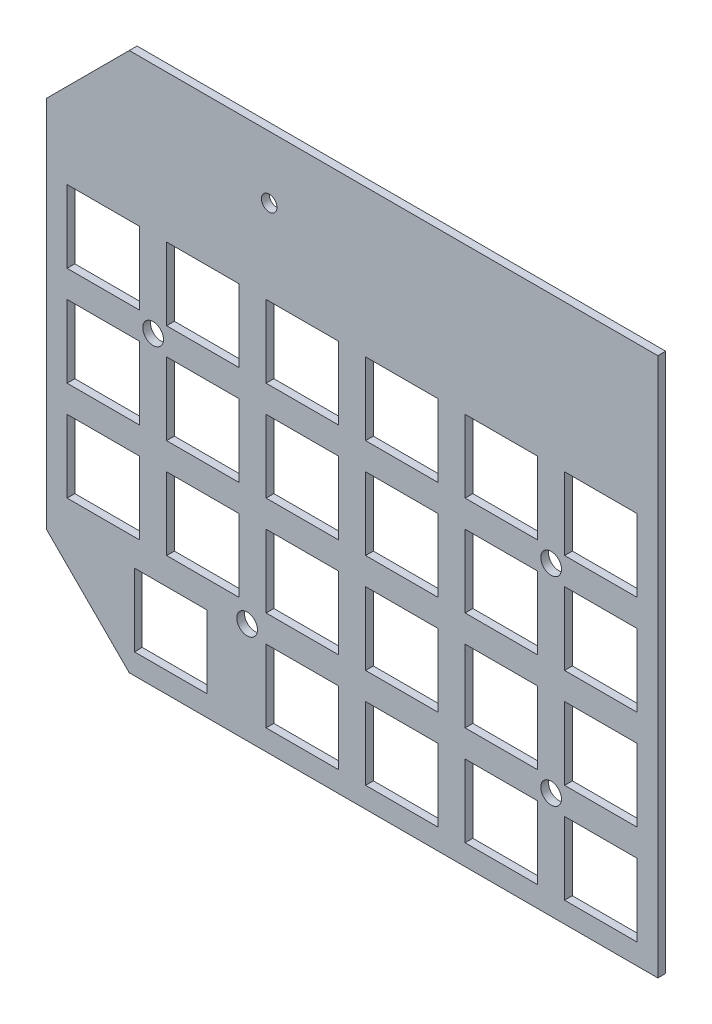
from build123d import *

# Parameters (mm, degrees)
BOSS_EXTRU_1_DEPTH      = 1.5
ESQUISSE3_R             = 2
ESQUISSE3_R_2           = 1.5
ESQUISSE3_W             = 14
ESQUISSE3_H             = 14
ENL_V_MAT_EXTRU_2_DEPTH = 10


with BuildPart() as part:
    # Esquisse1 → Boss.-Extru.1 (new body)
    with BuildSketch(Plane.XY):
        Polygon((0, -85), (16, -101), (118, -101), (118, 3), (16, 3), (0, -13), align=None)
    extrude(amount=BOSS_EXTRU_1_DEPTH)

    # Esquisse3 → Enlèv. mat.-Extru.2 (cut)
    with BuildSketch(Plane(origin=(0, 0, 0), x_dir=(-1, 0, 0), z_dir=(0, 0, -1))):
        with Locations((-97.4, -42)):
            Circle(ESQUISSE3_R)
        with Locations((-20.6, -42)):
            Circle(ESQUISSE3_R)
        with Locations((-38.73939693, -81.46060307)):
            Circle(ESQUISSE3_R)
        with Locations((-97.4, -80.4)):
            Circle(ESQUISSE3_R)
        with Locations((-43, -9)):
            Circle(ESQUISSE3_R_2)
        with Locations((-87.8, -32.4)):
            Rectangle(ESQUISSE3_W, ESQUISSE3_H)
        with Locations((-107, -32.4)):
            Rectangle(ESQUISSE3_W, ESQUISSE3_H)
        with Locations((-68.6, -32.4)):
            Rectangle(ESQUISSE3_W, ESQUISSE3_H)
        with Locations((-49.4, -32.4)):
            Rectangle(ESQUISSE3_W, ESQUISSE3_H)
        with Locations((-30.2, -32.4)):
            Rectangle(ESQUISSE3_W, ESQUISSE3_H)
        with Locations((-11, -32.4)):
            Rectangle(ESQUISSE3_W, ESQUISSE3_H)
        with Locations((-87.8, -51.6)):
            Rectangle(ESQUISSE3_W, ESQUISSE3_H)
        with Locations((-68.6, -51.6)):
            Rectangle(ESQUISSE3_W, ESQUISSE3_H)
        with Locations((-49.4, -51.6)):
            Rectangle(ESQUISSE3_W, ESQUISSE3_H)
        with Locations((-30.2, -51.6)):
            Rectangle(ESQUISSE3_W, ESQUISSE3_H)
        with Locations((-11, -51.6)):
            Rectangle(ESQUISSE3_W, ESQUISSE3_H)
        with Locations((-87.8, -70.8)):
            Rectangle(ESQUISSE3_W, ESQUISSE3_H)
        with Locations((-68.6, -70.8)):
            Rectangle(ESQUISSE3_W, ESQUISSE3_H)
        with Locations((-49.4, -70.8)):
            Rectangle(ESQUISSE3_W, ESQUISSE3_H)
        with Locations((-30.2, -70.8)):
            Rectangle(ESQUISSE3_W, ESQUISSE3_H)
        with Locations((-11, -70.8)):
            Rectangle(ESQUISSE3_W, ESQUISSE3_H)
        with Locations((-87.8, -90)):
            Rectangle(ESQUISSE3_W, ESQUISSE3_H)
        with Locations((-68.6, -90)):
            Rectangle(ESQUISSE3_W, ESQUISSE3_H)
        with Locations((-49.4, -90)):
            Rectangle(ESQUISSE3_W, ESQUISSE3_H)
        with Locations((-107, -51.6)):
            Rectangle(ESQUISSE3_W, ESQUISSE3_H)
        with Locations((-107, -70.8)):
            Rectangle(ESQUISSE3_W, ESQUISSE3_H)
        with Locations((-107, -90)):
            Rectangle(ESQUISSE3_W, ESQUISSE3_H)
        with Locations((-24, -90)):
            Rectangle(ESQUISSE3_W, ESQUISSE3_H)
    extrude(amount=-ENL_V_MAT_EXTRU_2_DEPTH, mode=Mode.SUBTRACT)


solid = part.part
